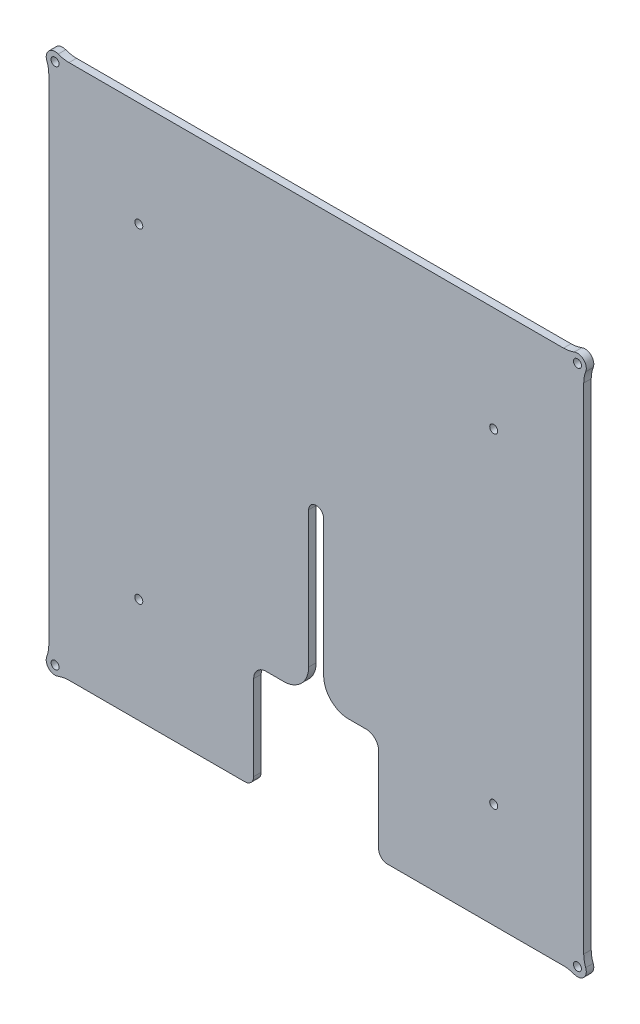
from build123d import *

# Parameters (mm, degrees)
SKETCH1_R           = 1.6
BOSS_EXTRUDE1_DEPTH = 3
SKETCH3_R           = 1.6
CUT_EXTRUDE2_DEPTH  = 153.814767522
CUT_EXTRUDE5_DEPTH  = 153.814767522
FILLET1_R           = 3.54


with BuildPart() as part:
    # Sketch1 → Boss-Extrude1 (new body)
    with BuildSketch(Plane.XY):
        with BuildLine():
            Line((-107, 98.923010333), (-107, -98.923010333))
            ThreePointArc((-107, -98.923010333), (-107.201661971, -101.11372249), (-107.799869959, -103.230804092))
            ThreePointArc((-107.799869959, -103.230804092), (-107, -107), (-103.230804092, -107.799869959))
            ThreePointArc((-103.230804092, -107.799869959), (-101.11372249, -107.201661971), (-98.923010333, -107))
            Line((-98.923010333, -107), (-43, -107))
            Line((-43, -107), (43, -107))
            Line((43, -107), (98.923010333, -107))
            ThreePointArc((98.923010333, -107), (101.11372249, -107.201661971), (103.230804092, -107.799869959))
            ThreePointArc((103.230804092, -107.799869959), (107, -107), (107.799869959, -103.230804092))
            ThreePointArc((107.799869959, -103.230804092), (107.201661971, -101.11372249), (107, -98.923010333))
            Line((107, -98.923010333), (107, 98.923010333))
            ThreePointArc((107, 98.923010333), (107.201661971, 101.11372249), (107.799869959, 103.230804092))
            ThreePointArc((107.799869959, 103.230804092), (107, 107), (103.230804092, 107.799869959))
            ThreePointArc((103.230804092, 107.799869959), (101.11372249, 107.201661971), (98.923010333, 107))
            Line((98.923010333, 107), (-98.923010333, 107))
            ThreePointArc((-98.923010333, 107), (-101.11372249, 107.201661971), (-103.230804092, 107.799869959))
            ThreePointArc((-103.230804092, 107.799869959), (-107, 107), (-107.799869959, 103.230804092))
            ThreePointArc((-107.799869959, 103.230804092), (-107.201661971, 101.11372249), (-107, 98.923010333))
        make_face()
        with Locations((-104.5, -104.5)):
            Circle(SKETCH1_R, mode=Mode.SUBTRACT)
        with Locations((-104.5, 104.5)):
            Circle(SKETCH1_R, mode=Mode.SUBTRACT)
        with Locations((104.5, 104.5)):
            Circle(SKETCH1_R, mode=Mode.SUBTRACT)
        with Locations((104.5, -104.5)):
            Circle(SKETCH1_R, mode=Mode.SUBTRACT)
    extrude(amount=BOSS_EXTRUDE1_DEPTH)

    # Sketch3 → Cut-Extrude2 (cut, through all)
    with BuildSketch(Plane.XY.offset(3)):
        with Locations((-71, 65)):
            Circle(SKETCH3_R)
        with Locations((71, 65)):
            Circle(SKETCH3_R)
        with Locations((71, -65)):
            Circle(SKETCH3_R)
        with Locations((-71, -65)):
            Circle(SKETCH3_R)
    extrude(amount=-CUT_EXTRUDE2_DEPTH, mode=Mode.SUBTRACT)

    # Sketch5 → Cut-Extrude5 (cut, through all)
    with BuildSketch(Plane.XY):
        with BuildLine():
            Line((-25.033358746, -107), (24.966641254, -107))
            Line((24.966641254, -107), (24.966641254, -69.5))
            ThreePointArc((24.966641254, -69.5), (23.50217516, -65.964466094), (19.966641254, -64.5))
            Line((19.966641254, -64.5), (12.966641254, -64.5))
            ThreePointArc((12.966641254, -64.5), (5.895573442, -61.571067812), (2.966641254, -54.5))
            Line((2.966641254, -54.5), (2.966641254, 0))
            ThreePointArc((2.966641254, 0), (-0.033358746, 3), (-3.033358746, 0))
            Line((-3.033358746, 0), (-3.033358746, -54.5))
            ThreePointArc((-3.033358746, -54.5), (-5.962290934, -61.571067812), (-13.033358746, -64.5))
            Line((-13.033358746, -64.5), (-20.033358746, -64.5))
            ThreePointArc((-20.033358746, -64.5), (-23.568892652, -65.964466094), (-25.033358746, -69.5))
            Line((-25.033358746, -69.5), (-25.033358746, -107))
        make_face()
    extrude(amount=CUT_EXTRUDE5_DEPTH, mode=Mode.SUBTRACT)

    # Fillet1
    fillet1_edges = [part.edges().sort_by_distance(p)[0] for p in [
        (-25.033358746, -107, 1.5),
        (24.966641254, -107, 1.5),
    ]]
    fillet(fillet1_edges, radius=FILLET1_R)


solid = part.part
